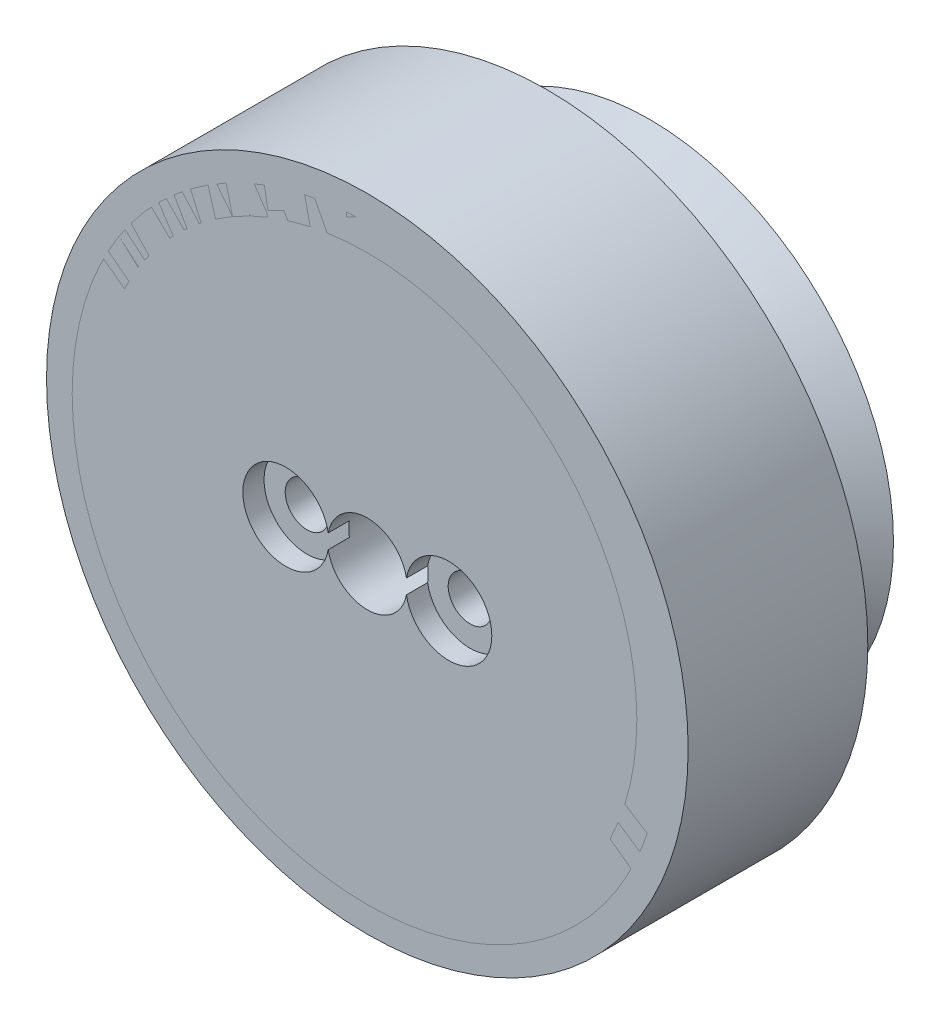
from build123d import *

# Parameters (mm, degrees)
SKETCH3_R                      = 23
SKETCH3_R_2                    = 3.1
WHEEL_BODY_DEPTH               = 14
PULLY_START                    = -6
SKETCH13_R                     = 16.5
SKETCH13_R_2                   = 3.1
PULLY_DEPTH                    = 6
SKETCH9_R                      = 25
SKETCH9_R_2                    = 21
MODIFER_DEPTH                  = 14
CLAMP_HOLE_DEPTH               = 6
TOOTH_START                    = -6
TOOTH_GEOMETETRY_DEPTH         = 6
CBORE_FOR_M3_SBHCS1_AT_2_COUNT = 2
CBORE_FOR_M3_SBHCS1_AT_2_PITCH = 12.7
TOOTH_PATTERN_DEPTH            = 6


# Read off the part's stored shape, not the designer's step: tooth pattern
with BuildPart() as part:
    # Sketch3 → wheel body (new body)
    with BuildSketch(Plane.XY):
        Circle(SKETCH3_R)
        Circle(SKETCH3_R_2, mode=Mode.SUBTRACT)
    extrude(amount=WHEEL_BODY_DEPTH)

    # Sketch13 → pully (add)
    with BuildSketch(Plane.XY.offset(PULLY_START)):
        Circle(SKETCH13_R)
        Circle(SKETCH13_R_2, mode=Mode.SUBTRACT)
    extrude(amount=PULLY_DEPTH)

    # Sketch16 → pulley holder (revolve)
    with BuildSketch(Plane(origin=(0, 0, 0), x_dir=(0, 0, -1), z_dir=(1, 0, 0)), mode=Mode.PRIVATE) as pulley_holder_sk:
        Polygon((8, 19), (6, 16.5), (6, 0), (8, 0), align=None)
    revolve(pulley_holder_sk.sketch.rotate(Axis((0, 0, -6), (0, 0, -1)), 90), axis=Axis((0, 0, -6), (0, 0, -1)))

    # Sketch6 → clamp hole (cut)
    with BuildSketch(Plane.XY.offset(-8)):
        Polygon((0, 11.313708499), (-11.313708499, 0), (0, -11.313708499), (11.313708499, 0), align=None)
    extrude(amount=CLAMP_HOLE_DEPTH, mode=Mode.SUBTRACT)

    # Sketch17 → tooth geometetry (cut)
    with BuildSketch(Plane.XY.offset(TOOTH_START)):
        with BuildLine():
            Line((3.302677209, 15.537874638), (3.430542898, 16.139435412))
            ThreePointArc((3.430542898, 16.139435412), (1.724719644, 16.409611274), (0, 16.5))
            Line((0, 16.5), (0, 15.885))
            ThreePointArc((0, 15.885), (0.256822167, 15.882923767), (0.513577199, 15.876695609))
            ThreePointArc((0.513577199, 15.876695609), (0.701107163, 15.787738172), (0.76376875, 15.589863368))
            ThreePointArc((0.76376875, 15.589863368), (1.538136337, 14.63438969), (2.494236282, 15.407983901))
            ThreePointArc((2.494236282, 15.407983901), (2.596669048, 15.58850659), (2.798596323, 15.636530421))
            ThreePointArc((2.798596323, 15.636530421), (3.051035549, 15.589240106), (3.302677209, 15.537874638))
        make_face()
    extrude(amount=TOOTH_GEOMETETRY_DEPTH, mode=Mode.SUBTRACT)

    # Sketch8 → CBORE for M3 SBHCS1 (revolve, cut)
    with BuildSketch(Plane(origin=(-6.35, 0, 14), x_dir=(0, -1, 0), z_dir=(1, 0, 0))):
        Polygon((0, 0), (0, 22), (1.7, 22), (1.7, 1.65), (3.35, 1.65), (3.35, 0), align=None)
    cbore_for_m3_sbhcs1 = revolve(axis=Axis((-6.35, 0, 20.35), (0, 0, -1)), mode=Mode.SUBTRACT)

    # CBORE for M3 SBHCS1 at 2: CBORE for M3 SBHCS1 ×2
    with Locations(*[(i * CBORE_FOR_M3_SBHCS1_AT_2_PITCH, 0, 0) for i in range(1, CBORE_FOR_M3_SBHCS1_AT_2_COUNT)]):
        add(cbore_for_m3_sbhcs1, mode=Mode.SUBTRACT)

    # tooth pattern outline → tooth pattern (cut)
    with BuildSketch(Plane.XY.offset(TOOTH_START)):
        with BuildLine():
            ThreePointArc((3.302677209, 15.537874638), (3.553455522, 15.482447444), (3.803304934, 15.422973014))
            ThreePointArc((3.803304934, 15.422973014), (3.968241627, 15.296969838), (3.988393423, 15.090390996))
            ThreePointArc((3.988393423, 15.090390996), (4.547185073, 13.994796637), (5.64323122, 14.552701602))
            ThreePointArc((5.64323122, 14.552701602), (5.780958362, 14.707982467), (5.988457757, 14.712973822))
            ThreePointArc((5.988457757, 14.712973822), (6.461011575, 14.511669595), (6.926809993, 14.29519249))
            ThreePointArc((6.926809993, 14.29519249), (7.06194489, 14.13765052), (7.038706165, 13.931396127))
            ThreePointArc((7.038706165, 13.931396127), (7.3575, 12.743563817), (8.545589874, 13.061396412))
            ThreePointArc((8.545589874, 13.061396412), (8.712592055, 13.184648934), (8.916594852, 13.146389666))
            ThreePointArc((8.916594852, 13.146389666), (9.336968733, 12.851234956), (9.747580216, 12.542643458))
            ThreePointArc((9.747580216, 12.542643458), (9.847007274, 12.360448033), (9.781393671, 12.163532397))
            ThreePointArc((9.781393671, 12.163532397), (9.846256872, 10.935376108), (11.074465244, 10.999245523))
            ThreePointArc((11.074465244, 10.999245523), (11.263443668, 11.085082976), (11.455033965, 11.005245198))
            ThreePointArc((11.455033965, 11.005245198), (11.804855553, 10.629139682), (12.14233441, 10.241920722))
            ThreePointArc((12.14233441, 10.241920722), (12.201708189, 10.043034656), (12.096587338, 9.864063934))
            ThreePointArc((12.096587338, 9.864063934), (11.904685072, 8.649259987), (13.119333343, 8.456374824))
            ThreePointArc((13.119333343, 8.456374824), (13.322028744, 8.5010457), (13.492833126, 8.383118706))
            ThreePointArc((13.492833126, 8.383118706), (13.756813539, 7.9425), (14.006410325, 7.493576903))
            ThreePointArc((14.006410325, 7.493576903), (14.023135907, 7.286692472), (13.883102093, 7.133488543))
            ThreePointArc((13.883102093, 7.133488543), (13.442821409, 5.985129703), (14.59082362, 5.543919967))
            ThreePointArc((14.59082362, 5.543919967), (14.798377238, 5.545471934), (14.940930734, 5.3946097))
            ThreePointArc((14.940930734, 5.3946097), (15.107532761, 4.908734956), (15.258338899, 4.417727816))
            ThreePointArc((15.258338899, 4.417727816), (15.231685294, 4.211886862), (15.062858667, 4.091145474))
            ThreePointArc((15.062858667, 4.091145474), (14.393441945, 3.059420531), (15.424624891, 2.389169206))
            ThreePointArc((15.424624891, 2.389169206), (15.627965636, 2.347534434), (15.736037974, 2.170330364))
            ThreePointArc((15.736037974, 2.170330364), (15.797980308, 1.660434639), (15.843404845, 1.148802824))
            ThreePointArc((15.843404845, 1.148802824), (15.774536945, 0.953001585), (15.584296039, 0.869999715))
            ThreePointArc((15.584296039, 0.869999715), (14.715, 0), (15.584296039, -0.869999715))
            ThreePointArc((15.584296039, -0.869999715), (15.774536945, -0.953001585), (15.843404845, -1.148802824))
            ThreePointArc((15.843404845, -1.148802824), (15.797980308, -1.660434639), (15.736037974, -2.170330364))
            ThreePointArc((15.736037974, -2.170330364), (15.627965636, -2.347534434), (15.424624891, -2.389169206))
            ThreePointArc((15.424624891, -2.389169206), (14.393441945, -3.059420531), (15.062858667, -4.091145474))
            ThreePointArc((15.062858667, -4.091145474), (15.231685294, -4.211886862), (15.258338899, -4.417727816))
            ThreePointArc((15.258338899, -4.417727816), (15.107532761, -4.908734956), (14.940930734, -5.3946097))
            ThreePointArc((14.940930734, -5.3946097), (14.798377238, -5.545471934), (14.59082362, -5.543919967))
            ThreePointArc((14.59082362, -5.543919967), (13.442821409, -5.985129703), (13.883102093, -7.133488543))
            ThreePointArc((13.883102093, -7.133488543), (14.023135907, -7.286692472), (14.006410325, -7.493576903))
            ThreePointArc((14.006410325, -7.493576903), (13.756813539, -7.9425), (13.492833126, -8.383118706))
            ThreePointArc((13.492833126, -8.383118706), (13.322028744, -8.5010457), (13.119333343, -8.456374824))
            ThreePointArc((13.119333343, -8.456374824), (11.904685072, -8.649259987), (12.096587338, -9.864063934))
            ThreePointArc((12.096587338, -9.864063934), (12.201708189, -10.043034656), (12.14233441, -10.241920722))
            ThreePointArc((12.14233441, -10.241920722), (11.804855553, -10.629139682), (11.455033965, -11.005245198))
            ThreePointArc((11.455033965, -11.005245198), (11.263443668, -11.085082976), (11.074465244, -10.999245523))
            ThreePointArc((11.074465244, -10.999245523), (9.846256872, -10.935376108), (9.781393671, -12.163532397))
            ThreePointArc((9.781393671, -12.163532397), (9.847007274, -12.360448033), (9.747580216, -12.542643458))
            ThreePointArc((9.747580216, -12.542643458), (9.336968733, -12.851234956), (8.916594852, -13.146389666))
            ThreePointArc((8.916594852, -13.146389666), (8.712592055, -13.184648934), (8.545589874, -13.061396412))
            ThreePointArc((8.545589874, -13.061396412), (7.3575, -12.743563817), (7.038706165, -13.931396127))
            ThreePointArc((7.038706165, -13.931396127), (7.06194489, -14.13765052), (6.926809993, -14.29519249))
            ThreePointArc((6.926809993, -14.29519249), (6.461011575, -14.511669595), (5.988457757, -14.712973822))
            ThreePointArc((5.988457757, -14.712973822), (5.780958362, -14.707982467), (5.64323122, -14.552701602))
            ThreePointArc((5.64323122, -14.552701602), (4.547185073, -13.994796637), (3.988393423, -15.090390996))
            ThreePointArc((3.988393423, -15.090390996), (3.968241627, -15.296969838), (3.803304934, -15.422973014))
            ThreePointArc((3.803304934, -15.422973014), (3.302677209, -15.537874638), (2.798596323, -15.636530421))
            ThreePointArc((2.798596323, -15.636530421), (2.596669048, -15.58850659), (2.494236282, -15.407983901))
            ThreePointArc((2.494236282, -15.407983901), (1.538136337, -14.63438969), (0.76376875, -15.589863368))
            ThreePointArc((0.76376875, -15.589863368), (0.701107163, -15.787738172), (0.513577199, -15.876695609))
            ThreePointArc((0.513577199, -15.876695609), (0, -15.885), (-0.513577199, -15.876695609))
            ThreePointArc((-0.513577199, -15.876695609), (-0.701107163, -15.787738172), (-0.76376875, -15.589863368))
            ThreePointArc((-0.76376875, -15.589863368), (-1.538136337, -14.63438969), (-2.494236282, -15.407983901))
            ThreePointArc((-2.494236282, -15.407983901), (-2.596669048, -15.58850659), (-2.798596323, -15.636530421))
            ThreePointArc((-2.798596323, -15.636530421), (-3.302677209, -15.537874638), (-3.803304934, -15.422973014))
            ThreePointArc((-3.803304934, -15.422973014), (-3.968241627, -15.296969838), (-3.988393423, -15.090390996))
            ThreePointArc((-3.988393423, -15.090390996), (-4.547185073, -13.994796637), (-5.64323122, -14.552701602))
            ThreePointArc((-5.64323122, -14.552701602), (-5.780958362, -14.707982467), (-5.988457757, -14.712973822))
            ThreePointArc((-5.988457757, -14.712973822), (-6.461011575, -14.511669595), (-6.926809993, -14.29519249))
            ThreePointArc((-6.926809993, -14.29519249), (-7.06194489, -14.13765052), (-7.038706165, -13.931396127))
            ThreePointArc((-7.038706165, -13.931396127), (-7.3575, -12.743563817), (-8.545589874, -13.061396412))
            ThreePointArc((-8.545589874, -13.061396412), (-8.712592055, -13.184648934), (-8.916594852, -13.146389666))
            ThreePointArc((-8.916594852, -13.146389666), (-9.336968733, -12.851234956), (-9.747580216, -12.542643458))
            ThreePointArc((-9.747580216, -12.542643458), (-9.847007274, -12.360448033), (-9.781393671, -12.163532397))
            ThreePointArc((-9.781393671, -12.163532397), (-9.846256872, -10.935376108), (-11.074465244, -10.999245523))
            ThreePointArc((-11.074465244, -10.999245523), (-11.263443668, -11.085082976), (-11.455033965, -11.005245198))
            ThreePointArc((-11.455033965, -11.005245198), (-11.804855553, -10.629139682), (-12.14233441, -10.241920722))
            ThreePointArc((-12.14233441, -10.241920722), (-12.201708189, -10.043034656), (-12.096587338, -9.864063934))
            ThreePointArc((-12.096587338, -9.864063934), (-11.904685072, -8.649259987), (-13.119333343, -8.456374824))
            ThreePointArc((-13.119333343, -8.456374824), (-13.322028744, -8.5010457), (-13.492833126, -8.383118706))
            ThreePointArc((-13.492833126, -8.383118706), (-13.756813539, -7.9425), (-14.006410325, -7.493576903))
            ThreePointArc((-14.006410325, -7.493576903), (-14.023135907, -7.286692472), (-13.883102093, -7.133488543))
            ThreePointArc((-13.883102093, -7.133488543), (-13.442821409, -5.985129703), (-14.59082362, -5.543919967))
            ThreePointArc((-14.59082362, -5.543919967), (-14.798377238, -5.545471934), (-14.940930734, -5.3946097))
            ThreePointArc((-14.940930734, -5.3946097), (-15.107532761, -4.908734956), (-15.258338899, -4.417727816))
            ThreePointArc((-15.258338899, -4.417727816), (-15.231685294, -4.211886862), (-15.062858667, -4.091145474))
            ThreePointArc((-15.062858667, -4.091145474), (-14.393441945, -3.059420531), (-15.424624891, -2.389169206))
            ThreePointArc((-15.424624891, -2.389169206), (-15.627965636, -2.347534434), (-15.736037974, -2.170330364))
            ThreePointArc((-15.736037974, -2.170330364), (-15.797980308, -1.660434639), (-15.843404845, -1.148802824))
            ThreePointArc((-15.843404845, -1.148802824), (-15.774536945, -0.953001585), (-15.584296039, -0.869999715))
            ThreePointArc((-15.584296039, -0.869999715), (-14.715, 0), (-15.584296039, 0.869999715))
            ThreePointArc((-15.584296039, 0.869999715), (-15.774536945, 0.953001585), (-15.843404845, 1.148802824))
            ThreePointArc((-15.843404845, 1.148802824), (-15.797980308, 1.660434639), (-15.736037974, 2.170330364))
            ThreePointArc((-15.736037974, 2.170330364), (-15.627965636, 2.347534434), (-15.424624891, 2.389169206))
            ThreePointArc((-15.424624891, 2.389169206), (-14.393441945, 3.059420531), (-15.062858667, 4.091145474))
            ThreePointArc((-15.062858667, 4.091145474), (-15.231685294, 4.211886862), (-15.258338899, 4.417727816))
            ThreePointArc((-15.258338899, 4.417727816), (-15.107532761, 4.908734956), (-14.940930734, 5.3946097))
            ThreePointArc((-14.940930734, 5.3946097), (-14.798377238, 5.545471934), (-14.59082362, 5.543919967))
            ThreePointArc((-14.59082362, 5.543919967), (-13.442821409, 5.985129703), (-13.883102093, 7.133488543))
            ThreePointArc((-13.883102093, 7.133488543), (-14.023135907, 7.286692472), (-14.006410325, 7.493576903))
            ThreePointArc((-14.006410325, 7.493576903), (-13.756813539, 7.9425), (-13.492833126, 8.383118706))
            ThreePointArc((-13.492833126, 8.383118706), (-13.322028744, 8.5010457), (-13.119333343, 8.456374824))
            ThreePointArc((-13.119333343, 8.456374824), (-11.904685072, 8.649259987), (-12.096587338, 9.864063934))
            ThreePointArc((-12.096587338, 9.864063934), (-12.201708189, 10.043034656), (-12.14233441, 10.241920722))
            ThreePointArc((-12.14233441, 10.241920722), (-11.804855553, 10.629139682), (-11.455033965, 11.005245198))
            ThreePointArc((-11.455033965, 11.005245198), (-11.263443668, 11.085082976), (-11.074465244, 10.999245523))
            ThreePointArc((-11.074465244, 10.999245523), (-9.846256872, 10.935376108), (-9.781393671, 12.163532397))
            ThreePointArc((-9.781393671, 12.163532397), (-9.847007274, 12.360448033), (-9.747580216, 12.542643458))
            ThreePointArc((-9.747580216, 12.542643458), (-9.336968733, 12.851234956), (-8.916594852, 13.146389666))
            ThreePointArc((-8.916594852, 13.146389666), (-8.712592055, 13.184648934), (-8.545589874, 13.061396412))
            ThreePointArc((-8.545589874, 13.061396412), (-7.3575, 12.743563817), (-7.038706165, 13.931396127))
            ThreePointArc((-7.038706165, 13.931396127), (-7.06194489, 14.13765052), (-6.926809993, 14.29519249))
            ThreePointArc((-6.926809993, 14.29519249), (-6.461011575, 14.511669595), (-5.988457757, 14.712973822))
            ThreePointArc((-5.988457757, 14.712973822), (-5.780958362, 14.707982467), (-5.64323122, 14.552701602))
            ThreePointArc((-5.64323122, 14.552701602), (-4.547185073, 13.994796637), (-3.988393423, 15.090390996))
            ThreePointArc((-3.988393423, 15.090390996), (-3.968241627, 15.296969838), (-3.803304934, 15.422973014))
            ThreePointArc((-3.803304934, 15.422973014), (-3.302677209, 15.537874638), (-2.798596323, 15.636530421))
            ThreePointArc((-2.798596323, 15.636530421), (-2.596669048, 15.58850659), (-2.494236282, 15.407983901))
            ThreePointArc((-2.494236282, 15.407983901), (-1.538136337, 14.63438969), (-0.76376875, 15.589863368))
            ThreePointArc((-0.76376875, 15.589863368), (-0.701107163, 15.787738172), (-0.513577199, 15.876695609))
            ThreePointArc((-0.513577199, 15.876695609), (-0.256822167, 15.882923767), (0, 15.885))
            Line((0, 15.885), (0, 16.5))
            ThreePointArc((0, 16.5), (-1.724719646, -16.409611274), (3.430542898, 16.139435412))
            Line((3.430542898, 16.139435412), (3.302677209, 15.537874638))
        make_face()
    extrude(amount=TOOTH_PATTERN_DEPTH, mode=Mode.SUBTRACT)


with BuildPart() as body_2:
    # Sketch9 → modifer (new body)
    with BuildSketch(Plane.XY):
        Circle(SKETCH9_R)
        Circle(SKETCH9_R_2, mode=Mode.SUBTRACT)
    extrude(amount=MODIFER_DEPTH)


solid = Compound([part.part, body_2.part])
